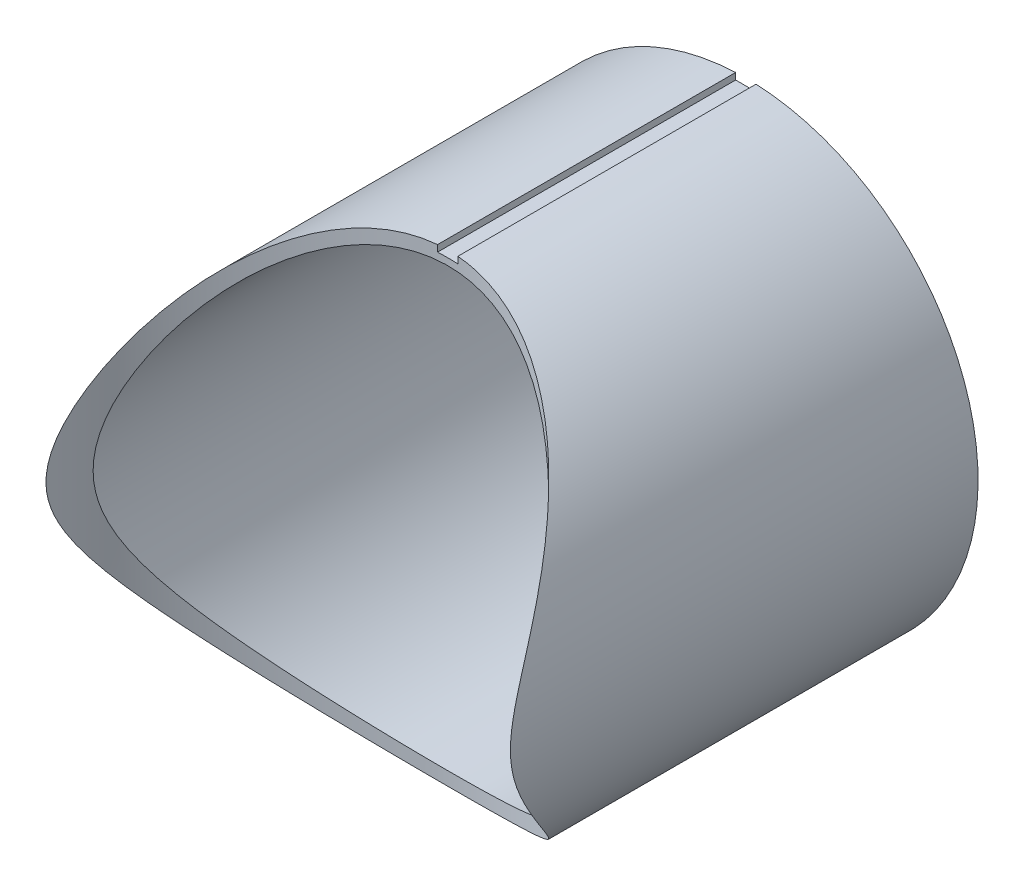
from build123d import *

# Parameters (mm, degrees)
SKETCH1_R               = 17.15
SKETCH1_R_2             = 16.15
BOSS_EXTRUDE1_DEPTH     = 40
SKETCH2_R               = 18
CUT_EXTRUDE1_DEPTH      = 370.72049578
CUT_EXTRUDE2_DEPTH      = 221.546684483
CUT_EXTRUDE2_DEPTH_BACK = 221.546684483


with BuildPart() as part:
    # Sketch1 → Boss-Extrude1 (new body)
    with BuildSketch(Plane.XY):
        with Locations((0, 200)):
            Circle(SKETCH1_R)
        with Locations((0, 200)):
            Circle(SKETCH1_R_2, mode=Mode.SUBTRACT)
    extrude(amount=-BOSS_EXTRUDE1_DEPTH)

    # Sketch2 → Cut-Extrude1 (cut, through all)
    with BuildSketch(Plane(origin=(0, 550, 0), x_dir=(1, 0, 0), z_dir=(0, 1, 0))):
        Circle(SKETCH2_R)
    extrude(amount=-CUT_EXTRUDE1_DEPTH, mode=Mode.SUBTRACT)

    # Sketch3 → Cut-Extrude2 (cut, two sides: drawn at the far end of the back side and taken through both)
    with BuildSketch(Plane(origin=(0, 0, -40), x_dir=(-1, 0, 0), z_dir=(0, 0, -1)).offset(-CUT_EXTRUDE2_DEPTH_BACK)):
        Polygon((-0.75, 304.484087012), (-0.75, 217.133592735), (-0.75, 216.65), (0.75, 216.65), (0.75, 217.133592735), (0.75, 304.484087012), (0.75, 479.185075567), (-0.75, 479.185075567), align=None)
    extrude(amount=CUT_EXTRUDE2_DEPTH + CUT_EXTRUDE2_DEPTH_BACK, mode=Mode.SUBTRACT)


solid = part.part
